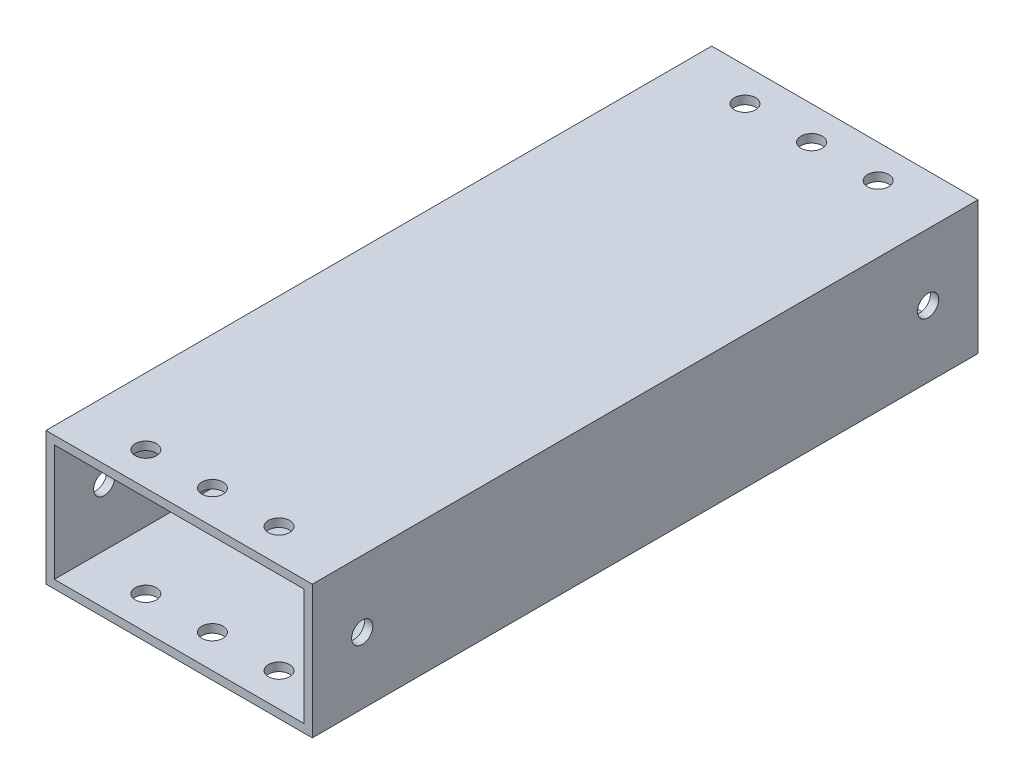
from build123d import *

# Parameters (mm, degrees)
SKETCH1_W           = 50.8
SKETCH1_H           = 25.4
SKETCH1_W_2         = 47.625
SKETCH1_H_2         = 22.225
BOSS_EXTRUDE1_DEPTH = 63.5
SKETCH2_R           = 2.0193
CUT_EXTRUDE1_DEPTH  = 73.955945611
SKETCH3_R           = 2.0193
CUT_EXTRUDE2_DEPTH  = 83.30540687


with BuildPart() as part:
    # Sketch1 → Boss-Extrude1 (new, symmetric)
    with BuildSketch(Plane.XY):
        Rectangle(SKETCH1_W, SKETCH1_H)
        Rectangle(SKETCH1_W_2, SKETCH1_H_2, mode=Mode.SUBTRACT)
    extrude(amount=BOSS_EXTRUDE1_DEPTH, both=True)

    # Sketch2 → Cut-Extrude1 (cut, through all)
    with BuildSketch(Plane(origin=(0, 12.7, 0), x_dir=(1, 0, 0), z_dir=(0, 1, 0))):
        with Locations((-12.7, 57.15)):
            Circle(SKETCH2_R)
        with Locations((0, 57.15)):
            Circle(SKETCH2_R)
        with Locations((12.7, 57.15)):
            Circle(SKETCH2_R)
        with Locations((12.7, -57.15)):
            Circle(SKETCH2_R)
        with Locations((0, -57.15)):
            Circle(SKETCH2_R)
        with Locations((-12.7, -57.15)):
            Circle(SKETCH2_R)
    extrude(amount=-CUT_EXTRUDE1_DEPTH, mode=Mode.SUBTRACT)

    # Sketch3 → Cut-Extrude2 (cut, through all)
    with BuildSketch(Plane.ZY.offset(25.4)):
        with Locations((-53.975, 0)):
            Circle(SKETCH3_R)
        with Locations((53.975, 0)):
            Circle(SKETCH3_R)
    extrude(amount=-CUT_EXTRUDE2_DEPTH, mode=Mode.SUBTRACT)


solid = part.part
